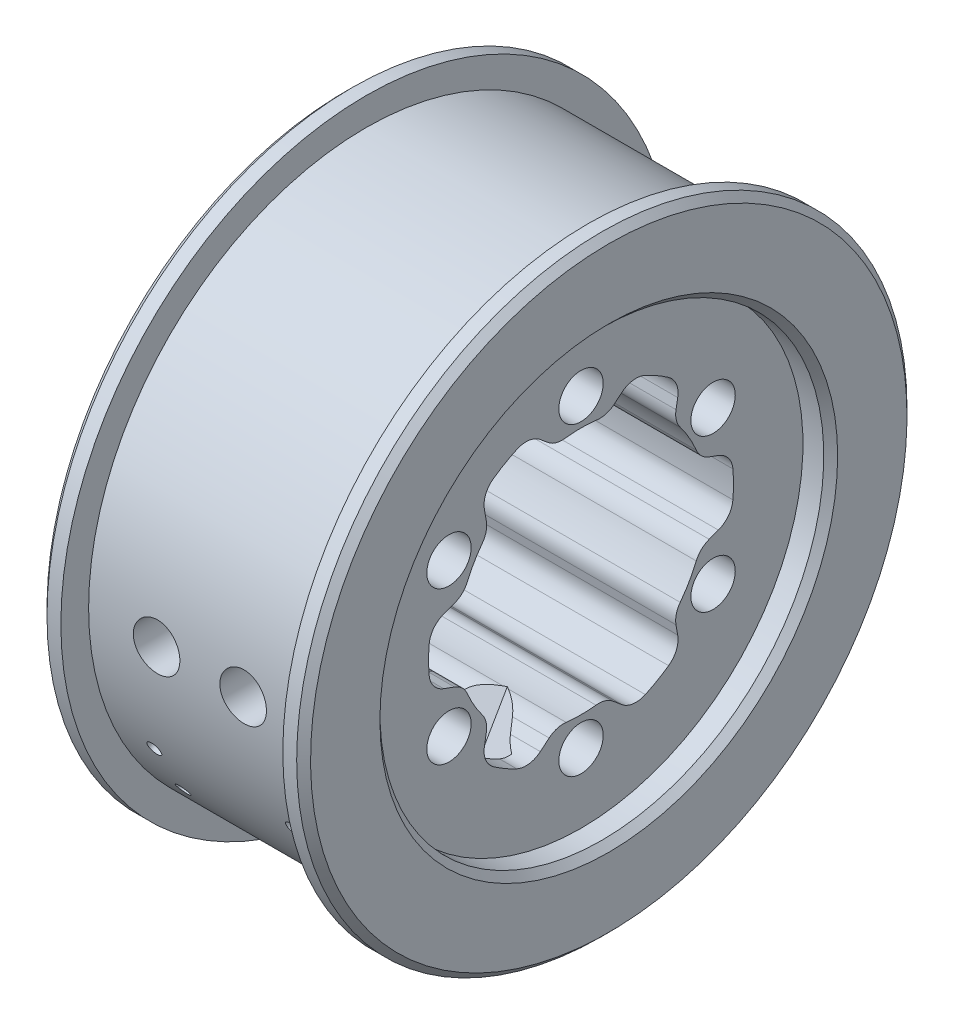
from build123d import *

# Parameters (mm, degrees)
SKETCH2_R           = 2.54
CUT_EXTRUDE3_DEPTH  = 58.873030474
SKETCH3_R           = 25.4
CUT_EXTRUDE4_DEPTH  = 3.175
CUT_EXTRUDE5_START  = -3.048
SKETCH4_R           = 25.4
CUT_EXTRUDE5_DEPTH  = 3.048
CHAMFER1_SIZE       = 0.79375
CUT_EXTRUDE6_START  = -5.08
CUT_EXTRUDE6_DEPTH  = 14.605
SKETCH10_R          = 2.667
CUT_EXTRUDE9_DEPTH  = 73.597630788
CIRPATTERN1_COUNT   = 2
CIRPATTERN1_ANGLE   = 60
SKETCH11_R          = 0.79375
CUT_EXTRUDE10_DEPTH = 65.837556879


with BuildPart() as part:
    # Sketch1 → Revolve1 (revolve)
    with BuildSketch(Plane.XY):
        Polygon((0, 0), (0, 31.75), (12.7, 31.75), (12.7, 34.925), (15.08125, 34.925), (15.08125, 0), align=None)
    revolve1 = revolve(axis=Axis((15.08125, 0, 0), (-1, 0, 0)))

    # Mirror3: Revolve1 across plane
    add(revolve1.mirror(Plane.ZY))

    # Sketch2 → Cut-Extrude3 (cut, through all)
    with BuildSketch(Plane(origin=(15.08125, 0, 0), x_dir=(0, 0, -1), z_dir=(1, 0, 0))):
        with Locations((0, 17.4498)):
            Circle(SKETCH2_R)
        with Locations((15.111970091, 8.7249)):
            Circle(SKETCH2_R)
        with Locations((15.111970091, -8.7249)):
            Circle(SKETCH2_R)
        with Locations((0, -17.4498)):
            Circle(SKETCH2_R)
        with Locations((-15.111970091, -8.7249)):
            Circle(SKETCH2_R)
        with Locations((-15.111970091, 8.7249)):
            Circle(SKETCH2_R)
        with BuildLine():
            Line((14.665568358, 4.08236111), (15.720738661, 3.698310528))
            ThreePointArc((15.720738661, 3.698310528), (16.866499311, 2.858560348), (17.382162096, 1.534913975))
            ThreePointArc((17.382162096, 1.534913975), (17.4498, 0), (17.382162096, -1.534913975))
            ThreePointArc((17.382162096, -1.534913975), (16.866499311, -2.858560348), (15.720738661, -3.698310528))
            Line((15.720738661, -3.698310528), (14.665568358, -4.08236111))
            ThreePointArc((14.665568358, -4.08236111), (13.779603056, -4.632705397), (13.189499594, -5.492700312))
            ThreePointArc((13.189499594, -5.492700312), (12.373337957, -7.14375), (11.351567802, -8.676091556))
            ThreePointArc((11.351567802, -8.676091556), (10.90184209, -9.617133602), (10.868212608, -10.659574204))
            Line((10.868212608, -10.659574204), (11.063200199, -11.765403783))
            ThreePointArc((11.063200199, -11.765403783), (10.908835536, -13.177536702), (10.020355543, -14.28593696))
            ThreePointArc((10.020355543, -14.28593696), (8.7249, -15.111970091), (7.361806553, -15.820850935))
            ThreePointArc((7.361806553, -15.820850935), (5.957663775, -16.03609705), (4.657538462, -15.46371431))
            Line((4.657538462, -15.46371431), (3.648569587, -14.617088899))
            ThreePointArc((3.648569587, -14.617088899), (2.738575306, -14.127821336), (1.709006412, -14.041448709))
            ThreePointArc((1.709006412, -14.041448709), (0, -14.145069274), (-1.709006412, -14.041448709))
            ThreePointArc((-1.709006412, -14.041448709), (-2.738575306, -14.127821336), (-3.648569587, -14.617088899))
            Line((-3.648569587, -14.617088899), (-4.657538462, -15.46371431))
            ThreePointArc((-4.657538462, -15.46371431), (-5.957663775, -16.03609705), (-7.361806553, -15.820850935))
            ThreePointArc((-7.361806553, -15.820850935), (-8.7249, -15.111970091), (-10.020355543, -14.28593696))
            ThreePointArc((-10.020355543, -14.28593696), (-10.908835536, -13.177536702), (-11.063200199, -11.765403783))
            Line((-11.063200199, -11.765403783), (-10.834485523, -10.468298399))
            ThreePointArc((-10.834485523, -10.468298399), (-10.865764524, -9.435586453), (-11.305748082, -8.500767323))
            ThreePointArc((-11.305748082, -8.500767323), (-12.249989329, -7.072534637), (-13.014754494, -5.540681386))
            ThreePointArc((-13.014754494, -5.540681386), (-13.60433983, -4.692234882), (-14.483055109, -4.1487905))
            Line((-14.483055109, -4.1487905), (-15.720738661, -3.698310528))
            ThreePointArc((-15.720738661, -3.698310528), (-16.866499311, -2.858560348), (-17.382162096, -1.534913975))
            ThreePointArc((-17.382162096, -1.534913975), (-17.4498, 0), (-17.382162096, 1.534913975))
            ThreePointArc((-17.382162096, 1.534913975), (-16.866499311, 2.858560348), (-15.720738661, 3.698310528))
            Line((-15.720738661, 3.698310528), (-14.483055109, 4.1487905))
            ThreePointArc((-14.483055109, 4.1487905), (-13.60433983, 4.692234882), (-13.014754494, 5.540681386))
            ThreePointArc((-13.014754494, 5.540681386), (-12.249989329, 7.072534637), (-11.305748082, 8.500767323))
            ThreePointArc((-11.305748082, 8.500767323), (-10.865764524, 9.435586453), (-10.834485523, 10.468298399))
            Line((-10.834485523, 10.468298399), (-11.063200199, 11.765403783))
            ThreePointArc((-11.063200199, 11.765403783), (-10.908835536, 13.177536702), (-10.020355543, 14.28593696))
            ThreePointArc((-10.020355543, 14.28593696), (-8.7249, 15.111970091), (-7.361806553, 15.820850935))
            ThreePointArc((-7.361806553, 15.820850935), (-5.957663775, 16.03609705), (-4.657538462, 15.46371431))
            Line((-4.657538462, 15.46371431), (-3.79735575, 14.741935314))
            ThreePointArc((-3.79735575, 14.741935314), (-2.877760966, 14.249838999), (-1.837931792, 14.168791867))
            ThreePointArc((-1.837931792, 14.168791867), (0, 14.2875), (1.837931792, 14.168791867))
            ThreePointArc((1.837931792, 14.168791867), (2.877760966, 14.249838999), (3.79735575, 14.741935314))
            Line((3.79735575, 14.741935314), (4.657538462, 15.46371431))
            ThreePointArc((4.657538462, 15.46371431), (5.957663775, 16.03609705), (7.361806553, 15.820850935))
            ThreePointArc((7.361806553, 15.820850935), (8.7249, 15.111970091), (10.020355543, 14.28593696))
            ThreePointArc((10.020355543, 14.28593696), (10.908835536, 13.177536702), (11.063200199, 11.765403783))
            Line((11.063200199, 11.765403783), (10.868212608, 10.659574204))
            ThreePointArc((10.868212608, 10.659574204), (10.90184209, 9.617133602), (11.351567802, 8.676091556))
            ThreePointArc((11.351567802, 8.676091556), (12.373337957, 7.14375), (13.189499594, 5.492700312))
            ThreePointArc((13.189499594, 5.492700312), (13.779603056, 4.632705397), (14.665568358, 4.08236111))
        make_face()
    extrude(amount=-CUT_EXTRUDE3_DEPTH, mode=Mode.SUBTRACT)

    # Sketch3 → Cut-Extrude4 (cut)
    with BuildSketch(Plane(origin=(15.08125, 0, 0), x_dir=(0, 0, -1), z_dir=(1, 0, 0))):
        Circle(SKETCH3_R)
    extrude(amount=-CUT_EXTRUDE4_DEPTH, mode=Mode.SUBTRACT)

    # Sketch4 → Cut-Extrude5 (cut)
    with BuildSketch(Plane.ZY.offset(15.08125).offset(CUT_EXTRUDE5_START)):
        Circle(SKETCH4_R)
    extrude(amount=CUT_EXTRUDE5_DEPTH, mode=Mode.SUBTRACT)

    # Chamfer1
    chamfer1_edges = [part.edges().sort_by_distance(p)[0] for p in [
        (-15.08125, 0, -25.4),
        (-15.08125, -34.925, 0),
        (15.08125, -34.925, 0),
        (15.08125, 0, 25.4),
    ]]
    chamfer(chamfer1_edges, length=CHAMFER1_SIZE)

    # Sketch7 → Cut-Extrude6 (cut)
    with BuildSketch(Plane.XY.offset(17.382162096).offset(CUT_EXTRUDE6_START)):
        Polygon((-4.92125, 5.60924654), (-9.779, 2.80462327), (-9.779, -2.80462327), (-4.92125, -5.60924654), (-0.0635, -2.80462327), (4.98475, -5.719231767), (9.93775, -2.859615883), (9.93775, 2.859615883), (4.98475, 5.719231767), (-0.0635, 2.80462327), align=None)
    cut_extrude6 = extrude(amount=CUT_EXTRUDE6_DEPTH, mode=Mode.SUBTRACT)

    # Sketch10 → Cut-Extrude9 (cut, through all)
    with BuildSketch(Plane(origin=(0, 0, 26.907162096), x_dir=(-1, 0, 0), z_dir=(0, 0, -1))):
        with Locations((-4.98475, 0)):
            Circle(SKETCH10_R)
        with Locations((4.92125, 0)):
            Circle(SKETCH10_R)
    cut_extrude9 = extrude(amount=-CUT_EXTRUDE9_DEPTH, mode=Mode.SUBTRACT)

    # CirPattern1: Cut-Extrude6, Cut-Extrude9 ×2 about axis
    cirpattern1_axis = Axis((15.08125, 0, 0), (1, 0, 0))
    add([cut_extrude6.rotate(cirpattern1_axis, i * CIRPATTERN1_ANGLE / (CIRPATTERN1_COUNT - 1)) for i in range(1, CIRPATTERN1_COUNT)], mode=Mode.SUBTRACT)
    add([cut_extrude9.rotate(cirpattern1_axis, i * CIRPATTERN1_ANGLE / (CIRPATTERN1_COUNT - 1)) for i in range(1, CIRPATTERN1_COUNT)], mode=Mode.SUBTRACT)

    # Sketch11 → Cut-Extrude10 (cut, through all)
    with BuildSketch(Plane(origin=(0, -7.020724354, 12.160251288), x_dir=(1, 0, 0), z_dir=(0, -0.49999999999999983, 0.8660254037844389))):
        with Locations((-7.9375, -3.296506412)):
            Circle(SKETCH11_R)
        with Locations((-7.9375, 3.296506412)):
            Circle(SKETCH11_R)
        with Locations((7.9375, 3.296506412)):
            Circle(SKETCH11_R)
        with Locations((7.9375, -3.296506412)):
            Circle(SKETCH11_R)
    extrude(amount=CUT_EXTRUDE10_DEPTH, mode=Mode.SUBTRACT)


solid = part.part
